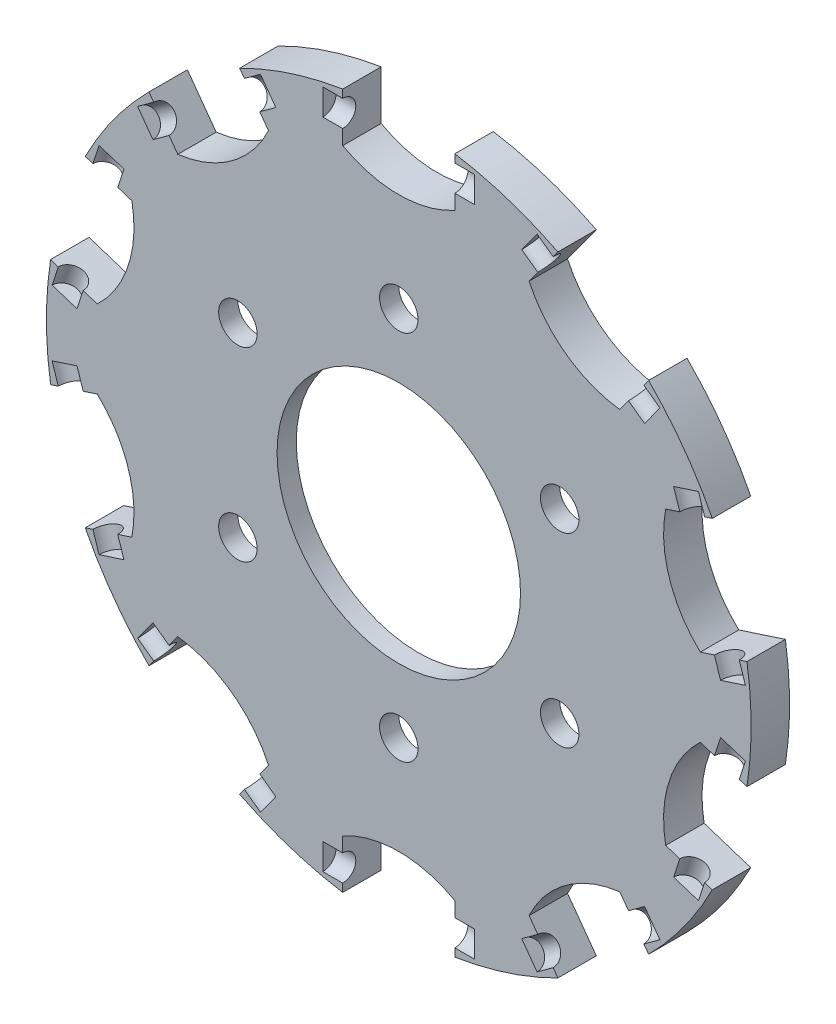
from build123d import *

# Parameters (mm, degrees)
SKETCH2_R           = 1.5
SKETCH2_R_2         = 9.5
BOSS_EXTRUDE2_DEPTH = 3
SKETCH2_4_R         = 18.75
SKETCH2_4_R_2       = 1.5
SKETCH2_4_R_3       = 9.5
BOSS_EXTRUDE3_DEPTH = 3
SKETCH3_W           = 11.85
SKETCH3_H           = 1.02
CIRPATTERN1_COUNT   = 10
SKETCH5_R           = 18.75
CUT_EXTRUDE2_DEPTH  = 1.5


with BuildPart() as part:
    # Sketch2 → Boss-Extrude2 (new body)
    with BuildSketch(Plane.XY):
        with BuildLine():
            Line((-4.375, 23.324003444), (-4.375, 27.149758286))
            ThreePointArc((-4.375, 27.149758286), (-8.497967345, 26.154054198), (-12.418778174, 24.536176326))
            Line((-12.418778174, 24.536176326), (-10.170055898, 21.441075642))
            ThreePointArc((-10.170055898, 21.441075642), (-13.044413657, 17.954095121), (-17.248954599, 16.297954684))
            Line((-17.248954599, 16.297954684), (-19.497676874, 19.393055368))
            ThreePointArc((-19.497676874, 19.393055368), (-22.247967345, 16.164094438), (-24.469005184, 12.550608962))
            Line((-24.469005184, 12.550608962), (-20.830496111, 11.3683857))
            ThreePointArc((-20.830496111, 11.3683857), (-21.106304661, 6.857854099), (-23.534394812, 3.046641182))
            Line((-23.534394812, 3.046641182), (-27.172903884, 4.228864445))
            ThreePointArc((-27.172903884, 4.228864445), (-27.5, 0), (-27.172903884, -4.228864445))
            Line((-27.172903884, -4.228864445), (-23.534394812, -3.046641182))
            ThreePointArc((-23.534394812, -3.046641182), (-21.106304661, -6.857854099), (-20.830496111, -11.3683857))
            Line((-20.830496111, -11.3683857), (-24.469005184, -12.550608962))
            ThreePointArc((-24.469005184, -12.550608962), (-22.247967345, -16.164094438), (-19.497676874, -19.393055368))
            Line((-19.497676874, -19.393055368), (-17.248954599, -16.297954684))
            ThreePointArc((-17.248954599, -16.297954684), (-13.044413657, -17.954095121), (-10.170055898, -21.441075642))
            Line((-10.170055898, -21.441075642), (-12.418778174, -24.536176326))
            ThreePointArc((-12.418778174, -24.536176326), (-8.497967345, -26.154054198), (-4.375, -27.149758286))
            Line((-4.375, -27.149758286), (-4.375, -23.324003444))
            ThreePointArc((-4.375, -23.324003444), (0, -22.192482044), (4.375, -23.324003444))
            Line((4.375, -23.324003444), (4.375, -27.149758286))
            ThreePointArc((4.375, -27.149758286), (8.497967345, -26.154054198), (12.418778174, -24.536176326))
            Line((12.418778174, -24.536176326), (10.170055898, -21.441075642))
            ThreePointArc((10.170055898, -21.441075642), (13.044413657, -17.954095121), (17.248954599, -16.297954684))
            Line((17.248954599, -16.297954684), (19.497676874, -19.393055368))
            ThreePointArc((19.497676874, -19.393055368), (22.247967345, -16.164094438), (24.469005184, -12.550608962))
            Line((24.469005184, -12.550608962), (20.830496111, -11.3683857))
            ThreePointArc((20.830496111, -11.3683857), (21.106304661, -6.857854099), (23.534394812, -3.046641182))
            Line((23.534394812, -3.046641182), (27.172903884, -4.228864445))
            ThreePointArc((27.172903884, -4.228864445), (27.5, 0), (27.172903884, 4.228864445))
            Line((27.172903884, 4.228864445), (23.534394812, 3.046641182))
            ThreePointArc((23.534394812, 3.046641182), (21.106304661, 6.857854099), (20.830496111, 11.3683857))
            Line((20.830496111, 11.3683857), (24.469005184, 12.550608962))
            ThreePointArc((24.469005184, 12.550608962), (22.247967345, 16.164094438), (19.497676874, 19.393055368))
            Line((19.497676874, 19.393055368), (17.248954599, 16.297954684))
            ThreePointArc((17.248954599, 16.297954684), (13.044413657, 17.954095121), (10.170055898, 21.441075642))
            Line((10.170055898, 21.441075642), (12.418778174, 24.536176326))
            ThreePointArc((12.418778174, 24.536176326), (8.497967345, 26.154054198), (4.375, 27.149758286))
            Line((4.375, 27.149758286), (4.375, 23.324003444))
            ThreePointArc((4.375, 23.324003444), (0, 22.192482044), (-4.375, 23.324003444))
        make_face()
        with Locations((0, 14.5)):
            Circle(SKETCH2_R, mode=Mode.SUBTRACT)
        with Locations((-12.557368355, -7.25)):
            Circle(SKETCH2_R, mode=Mode.SUBTRACT)
        with Locations((0, -14.5)):
            Circle(SKETCH2_R, mode=Mode.SUBTRACT)
        with Locations((12.557368355, -7.25)):
            Circle(SKETCH2_R, mode=Mode.SUBTRACT)
        with Locations((-12.557368355, 7.25)):
            Circle(SKETCH2_R, mode=Mode.SUBTRACT)
        Circle(SKETCH2_R_2, mode=Mode.SUBTRACT)
        with Locations((12.557368355, 7.25)):
            Circle(SKETCH2_R, mode=Mode.SUBTRACT)
    extrude(amount=BOSS_EXTRUDE2_DEPTH)

    # Sketch2<4> → Boss-Extrude3 (add)
    with BuildSketch(Plane.XY):
        Circle(SKETCH2_4_R)
        with Locations((-12.557368355, -7.25)):
            Circle(SKETCH2_4_R_2, mode=Mode.SUBTRACT)
        with Locations((0, -14.5)):
            Circle(SKETCH2_4_R_2, mode=Mode.SUBTRACT)
        with Locations((12.557368355, -7.25)):
            Circle(SKETCH2_4_R_2, mode=Mode.SUBTRACT)
        with Locations((-12.557368355, 7.25)):
            Circle(SKETCH2_4_R_2, mode=Mode.SUBTRACT)
        Circle(SKETCH2_4_R_3, mode=Mode.SUBTRACT)
        with Locations((12.557368355, 7.25)):
            Circle(SKETCH2_4_R_2, mode=Mode.SUBTRACT)
        with Locations((0, 14.5)):
            Circle(SKETCH2_4_R_2, mode=Mode.SUBTRACT)
    extrude(amount=BOSS_EXTRUDE3_DEPTH)

    # Sketch3 → Cut-Revolve1 (revolve, cut)
    with BuildSketch(Plane.XY.offset(3)):
        with Locations((0, 26.01)):
            Rectangle(SKETCH3_W, SKETCH3_H)
    cut_revolve1 = revolve(axis=Axis((5.925, 25.5, 3), (-1, 0, 0)), mode=Mode.SUBTRACT)

    # CirPattern1: Cut-Revolve1 ×10 about axis
    cirpattern1_axis = Axis((0, 0, 0), (0, 0, 1))
    for i in range(1, CIRPATTERN1_COUNT):
        add(cut_revolve1.rotate(cirpattern1_axis, i * 360 / CIRPATTERN1_COUNT), mode=Mode.SUBTRACT)

    # Sketch5 → Cut-Extrude2 (cut)
    with BuildSketch(Plane(origin=(0, 0, 0), x_dir=(-1, 0, 0), z_dir=(0, 0, -1))):
        Circle(SKETCH5_R)
    extrude(amount=-CUT_EXTRUDE2_DEPTH, mode=Mode.SUBTRACT)


solid = part.part
